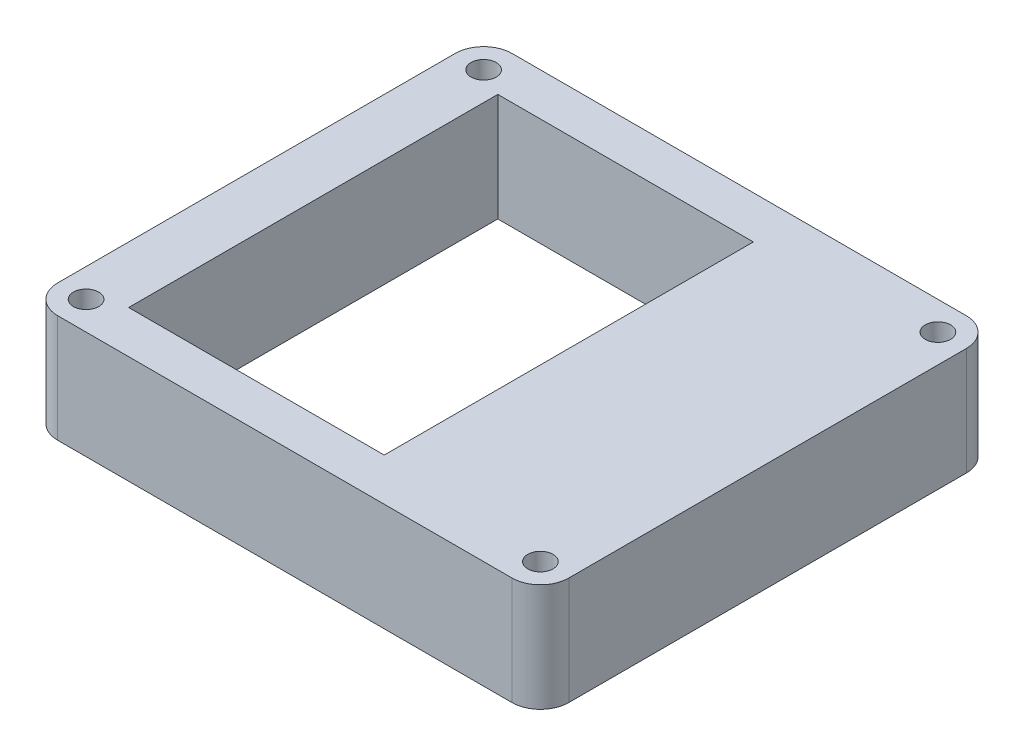
from build123d import *

# Parameters (mm, degrees)
SKETCH1_W             = 45.72
SKETCH1_H             = 40.64
BODY_DEPTH            = 4.826
FILLET1_R             = 2.54
F_4_40_TAPPED_HOLE1_D = 2.2606
SKETCH4_W             = 22.86
SKETCH4_H             = 33.02
CUT_EXTRUDE1_DEPTH    = 33.072466447


with BuildPart() as part:
    # Sketch1 → Body (new, symmetric)
    with BuildSketch(Plane(origin=(0, 0, 0), x_dir=(1, 0, 0), z_dir=(0, 1, 0))):
        Rectangle(SKETCH1_W, SKETCH1_H)
    extrude(amount=BODY_DEPTH, both=True)

    # Fillet1
    fillet1_edges = [part.edges().sort_by_distance(p)[0] for p in [
        (22.86, 0, -20.32),
        (-22.86, 0, -20.32),
        (22.86, 0, 20.32),
        (-22.86, 0, 20.32),
    ]]
    fillet(fillet1_edges, radius=FILLET1_R)

    # #4-40 Tapped Hole1 (through all)
    with Locations(Plane(origin=(0, 4.826, 0), x_dir=(1, 0, 0), z_dir=(0, 1, 0))):
        with Locations((20.32, 17.78), (-20.32, -17.78), (-20.32, 17.78), (20.32, -17.78)):
            Hole(F_4_40_TAPPED_HOLE1_D / 2)

    # Sketch4 → Cut-Extrude1 (cut, through all)
    with BuildSketch(Plane(origin=(0, 4.826, 0), x_dir=(1, 0, 0), z_dir=(0, 1, 0))):
        with Locations((-6.35, 0)):
            Rectangle(SKETCH4_W, SKETCH4_H)
    extrude(amount=-CUT_EXTRUDE1_DEPTH, mode=Mode.SUBTRACT)


solid = part.part
